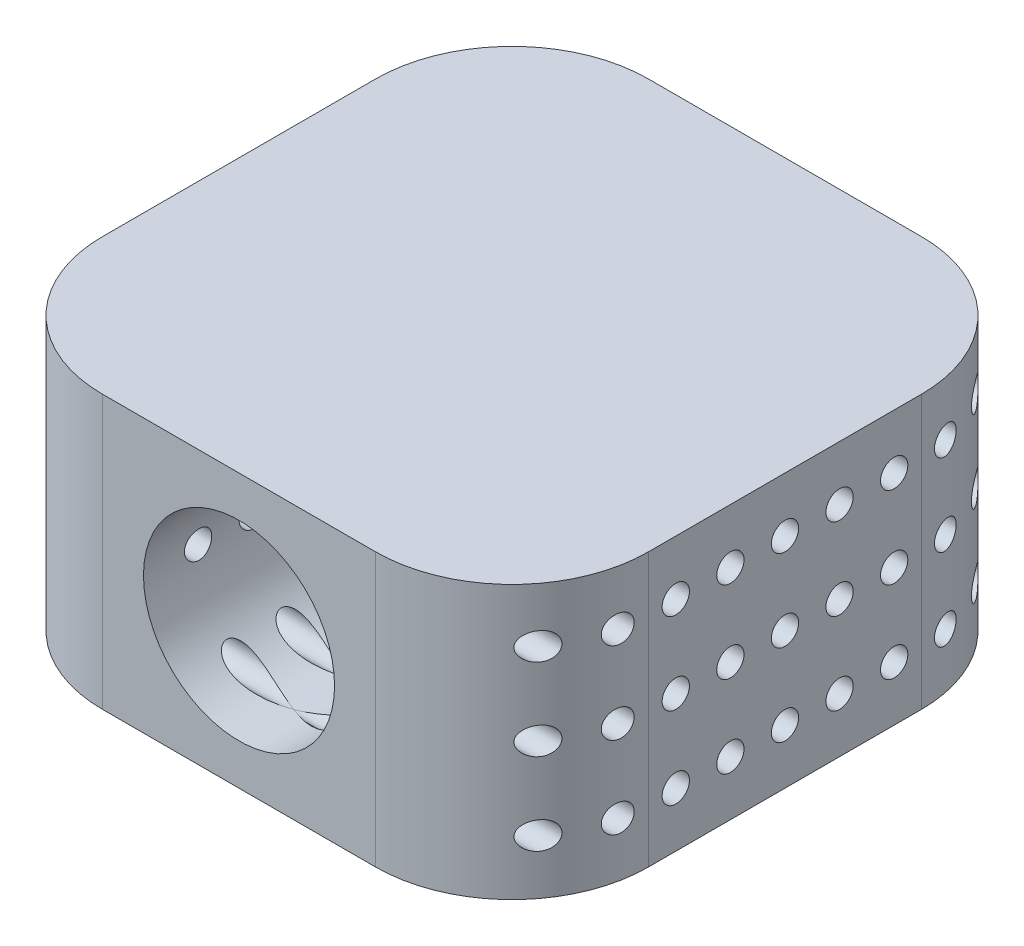
from build123d import *

# Parameters (mm, degrees)
SKETCH1_W           = 10
SKETCH1_H           = 10
BOSS_EXTRUDE1_DEPTH = 2.5
SKETCH3_R           = 0.25
CUT_EXTRUDE1_DEPTH  = 12.456439237
FILLET1_R           = 2.5
SKETCH4_R           = 1.75
CUT_EXTRUDE5_DEPTH  = 12.45643939


with BuildPart() as part:
    # Sketch1 → Boss-Extrude1 (new, symmetric)
    with BuildSketch(Plane(origin=(0, 0, 0), x_dir=(1, 0, 0), z_dir=(0, 1, 0))):
        Rectangle(SKETCH1_W, SKETCH1_H)
    extrude(amount=BOSS_EXTRUDE1_DEPTH, both=True)

    # Sketch3 → Cut-Extrude1 (cut, through all)
    with BuildSketch(Plane.ZY.offset(5)):
        Circle(SKETCH3_R)
        with Locations((1, 0)):
            Circle(SKETCH3_R)
        with Locations((2, 0)):
            Circle(SKETCH3_R)
        with Locations((3, 0)):
            Circle(SKETCH3_R)
        with Locations((4, 0)):
            Circle(SKETCH3_R)
        with Locations(Location((-4, 0, 0), (0, 0, 180))):
            Circle(SKETCH3_R)
        with Locations(Location((-3, 0, 0), (0, 0, 180))):
            Circle(SKETCH3_R)
        with Locations(Location((-2, 0, 0), (0, 0, 180))):
            Circle(SKETCH3_R)
        with Locations(Location((-1, 0, 0), (0, 0, 180))):
            Circle(SKETCH3_R)
        with Locations(Location((-4, 1.5, 0), (0, 0, 180))):
            Circle(SKETCH3_R)
        with Locations(Location((-3, 1.5, 0), (0, 0, 180))):
            Circle(SKETCH3_R)
        with Locations(Location((-2, 1.5, 0), (0, 0, 180))):
            Circle(SKETCH3_R)
        with Locations(Location((-1, 1.5, 0), (0, 0, 180))):
            Circle(SKETCH3_R)
        with Locations((0, 1.5)):
            Circle(SKETCH3_R)
        with Locations((1, 1.5)):
            Circle(SKETCH3_R)
        with Locations((2, 1.5)):
            Circle(SKETCH3_R)
        with Locations((3, 1.5)):
            Circle(SKETCH3_R)
        with Locations((4, 1.5)):
            Circle(SKETCH3_R)
        with Locations(Location((4, -1.5, 0), (0, 0, 180))):
            Circle(SKETCH3_R)
        with Locations(Location((3, -1.5, 0), (0, 0, 180))):
            Circle(SKETCH3_R)
        with Locations(Location((2, -1.5, 0), (0, 0, 180))):
            Circle(SKETCH3_R)
        with Locations(Location((1, -1.5, 0), (0, 0, 180))):
            Circle(SKETCH3_R)
        with Locations(Location((0, -1.5, 0), (0, 0, 180))):
            Circle(SKETCH3_R)
        with Locations((-1, -1.5)):
            Circle(SKETCH3_R)
        with Locations((-2, -1.5)):
            Circle(SKETCH3_R)
        with Locations((-3, -1.5)):
            Circle(SKETCH3_R)
        with Locations((-4, -1.5)):
            Circle(SKETCH3_R)
    extrude(amount=-CUT_EXTRUDE1_DEPTH, mode=Mode.SUBTRACT)

    # Fillet1
    # the kernel refuses this fillet: 2.5 mm, written as the material it takes off along each edge
    with BuildSketch(Plane(origin=(5, -8.75, 5), x_dir=(-1, 0, 0), z_dir=(0, 1, 0)), Plane(origin=(-5, 8.75, 5), x_dir=(1, 0, 0), z_dir=(0, -1, 0)), Plane(origin=(-5, 8.75, -5), x_dir=(0, 0, 1), z_dir=(0, -1, 0)), Plane(origin=(5, -8.75, -5), x_dir=(0, 0, 1), z_dir=(0, 1, 0))) as fillet1_piece_1:
        with BuildLine():
            CenterArc((FILLET1_R, -FILLET1_R), FILLET1_R, 90, 90)
            Line((0, -FILLET1_R), (0, 0))
            Line((0, 0), (FILLET1_R, 0))
        make_face()
    extrude(amount=17.5, mode=Mode.SUBTRACT)

    # Sketch4 → Cut-Extrude5 (cut, through all)
    with BuildSketch(Plane.XY.offset(5)):
        Circle(SKETCH4_R)
    extrude(amount=-CUT_EXTRUDE5_DEPTH, mode=Mode.SUBTRACT)


solid = part.part
